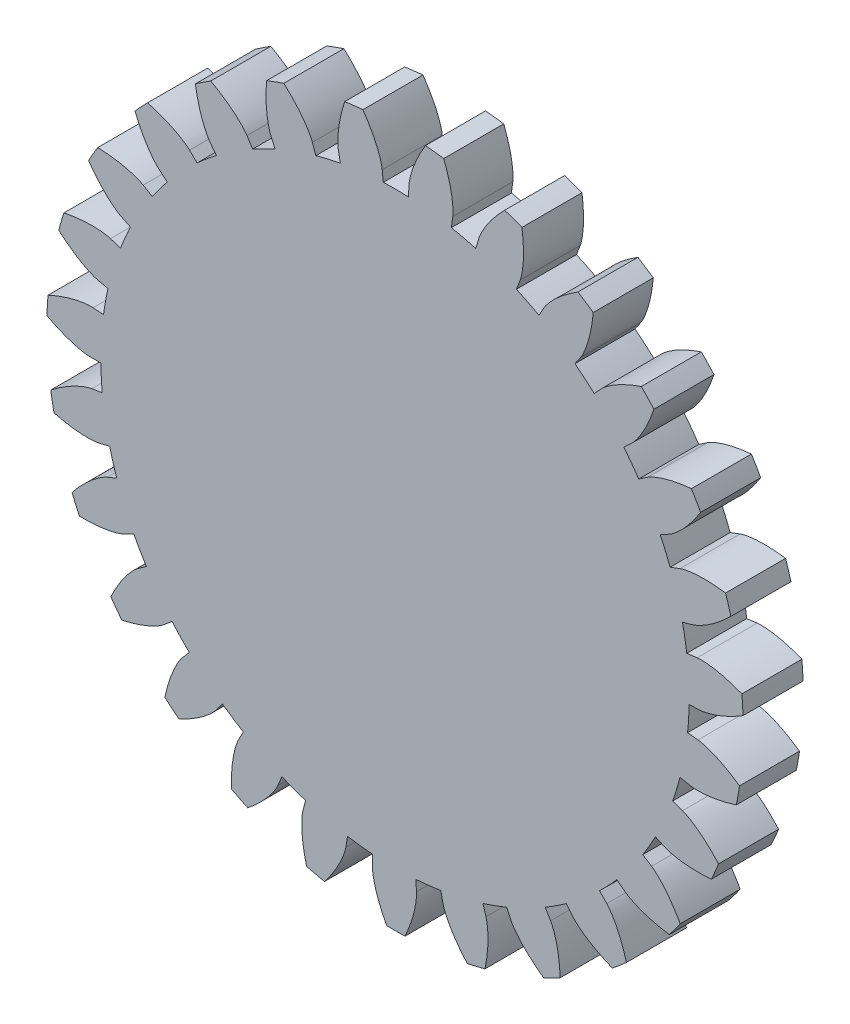
from build123d import *

# Parameters (mm, degrees)
SKETCH_2_R               = 58
EXTRUDE_1_DEPTH          = 10
CUT_EXTRUDE_1_DEPTH      = 83.63171304
PATTERN_CIRCULAR_2_COUNT = 27


with BuildPart() as part:
    # Эскиз2 → Бобышка-Вытянуть1 (new body)
    with BuildSketch(Plane.XY):
        Circle(SKETCH_2_R)
    extrude(amount=EXTRUDE_1_DEPTH)

    # Эскиз2<6> → Вырез-Вытянуть1 (cut, through all)
    with BuildSketch(Plane.XY):
        with BuildLine():
            Line((2.238854931, 48.94882561), (2.320476563, 50.690316497))
            add(Edge.make_bspline(
                [(2.320476563, 50.690316497), (2.324374699, 50.77348768), (2.337125961, 50.93941336), (2.379248014, 51.253499243), (2.464646733, 51.712580618), (2.651787216, 52.497585212), (3.038368066, 53.720245814), (3.649376291, 55.200837143), (4.313691919, 56.490337546), (4.829089996, 57.377813961), (5.07308238, 57.777710539)],
                knots=[0, 0, 0, 0, 0, 0.002802036, 0.005604071, 0.010661162, 0.015718253, 0.029959921, 0.048733673, 0.064506611, 0.064506611, 0.064506611, 0.064506611, 0.064506611], degree=4))
            ThreePointArc((5.07308238, 57.777710539), (-0.137420832, 57.999837202), (-5.346812966, 57.753022355))
            add(Edge.make_bspline(
                [(-2.130434364, 50.698659228), (-2.138800792, 50.781500304), (-2.160459051, 50.946499837), (-2.219415395, 51.257865151), (-2.329385331, 51.711688094), (-2.558481754, 52.485489491), (-3.010272138, 53.685584966), (-3.716458166, 55.165574682), (-4.471330008, 56.448799772), (-5.05792276, 57.336963672), (-5.346812966, 57.753022355)],
                knots=[0, 0, 0, 0, 0, 0.002802036, 0.005604071, 0.010661162, 0.015718253, 0.029959921, 0.048733673, 0.065788301, 0.065788301, 0.065788301, 0.065788301, 0.065788301], degree=4))
            Line((-2.130434364, 50.698659228), (-1.954940355, 48.960986593))
            ThreePointArc((-1.954940355, 48.960986593), (0.142087452, 48.999793991), (2.238854931, 48.94882561))
        make_face()
    cut_extrude_1 = extrude(amount=CUT_EXTRUDE_1_DEPTH, mode=Mode.SUBTRACT)

    # Круговой массив2: Вырез-Вытянуть1 ×27 about axis
    pattern_circular_2_axis = Axis((0, 0, 10), (0, 0, -1))
    for i in range(1, PATTERN_CIRCULAR_2_COUNT):
        add(cut_extrude_1.rotate(pattern_circular_2_axis, i * 360 / PATTERN_CIRCULAR_2_COUNT), mode=Mode.SUBTRACT)


solid = part.part
